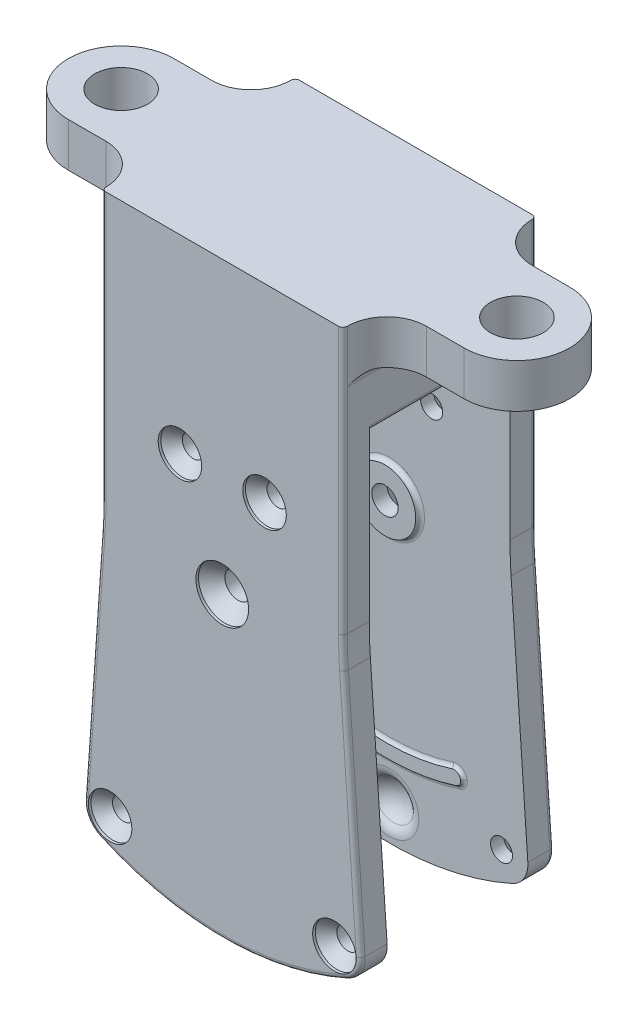
from build123d import *

# Parameters (mm, degrees)
SKETCH1_R                                      = 1.25
SKETCH1_R_2                                    = 1.5
BOSS_EXTRUDE1_DEPTH                            = 3
SKETCH6_W                                      = 27.433011382
SKETCH6_H                                      = 22
BOSS_EXTRUDE2_DEPTH                            = 7
BOSS_EXTRUDE3_DEPTH                            = 8
CSK_FOR_M2_5_FLAT_HEAD_MACHINE_SCREW1_AT_COUNT = 2
CSK_FOR_M2_5_FLAT_HEAD_MACHINE_SCREW1_AT_PITCH = 9.618218297
CSK_FOR_M2_5_FLAT_HEAD_MACHINE_SCREW_2_COUNT   = 2
CSK_FOR_M2_5_FLAT_HEAD_MACHINE_SCREW_2_PITCH   = 40.473868267
CSK_FOR_M2_5_FLAT_HEAD_MACHINE_SCREW_3_COUNT   = 2
CSK_FOR_M2_5_FLAT_HEAD_MACHINE_SCREW_3_PITCH   = 43.398601527
CSK_FOR_M2_5_FLAT_HEAD_MACHINE_SCREW2_AT_COUNT = 2
CSK_FOR_M2_5_FLAT_HEAD_MACHINE_SCREW2_AT_PITCH = 9.618218297
CSK_FOR_M2_5_FLAT_HEAD_MACHINE_SCREW_4_COUNT   = 2
CSK_FOR_M2_5_FLAT_HEAD_MACHINE_SCREW_4_PITCH   = 40.473868267
CSK_FOR_M2_5_FLAT_HEAD_MACHINE_SCREW_5_COUNT   = 2
CSK_FOR_M2_5_FLAT_HEAD_MACHINE_SCREW_5_PITCH   = 43.398601527
SKETCH18_R                                     = 0.5
BOSS_EXTRUDE4_DEPTH                            = 2.5
BOSS_EXTRUDE5_DEPTH                            = 0.3
BOSS_EXTRUDE7_START                            = 0.3
BOSS_EXTRUDE7_DEPTH                            = 0.3
SKETCH22_R                                     = 3.5
SKETCH22_R_2                                   = 1.5
BOSS_EXTRUDE8_DEPTH                            = 0.5
BOSS_EXTRUDE9_START                            = 0.5
SKETCH23_R                                     = 3.5
SKETCH23_R_2                                   = 1.5
BOSS_EXTRUDE9_DEPTH                            = 0.5
FILLET4_R                                      = 0.5
FILLET7_R                                      = 0.75
FILLET6_R                                      = 0.5
FILLET9_R                                      = 0.5
FILLET10_R                                     = 1.5
FILLET12_R                                     = 1.9
FILLET11_R                                     = 0.5
BOSS_EXTRUDE11_DEPTH                           = 3
SKETCH24_R                                     = 6
SKETCH24_R_2                                   = 3
BOSS_EXTRUDE10_DEPTH                           = 5
FILLET13_R                                     = 4.5
FILLET14_R                                     = 1


# Some blends are built 0.0001 mm under size
with BuildPart() as part:
    # Sketch1 → Boss-Extrude1 (new body)
    with BuildSketch(Plane.XY):
        with BuildLine():
            Line((13.716505691, 23), (-13.716505691, 23))
            Line((-13.716505691, 23), (-13.716505691, 2.705189989))
            ThreePointArc((-13.716505691, 2.705189989), (-13.74696434, 0.960215153), (-13.838303178, -0.782633699))
            Line((-13.838303178, -0.782633699), (-15.74477338, -28.04642778))
            ThreePointArc((-15.74477338, -28.04642778), (-15.327486992, -29.79429564), (-13.986153606, -30.990119511))
            ThreePointArc((-13.986153606, -30.990119511), (0, -34), (13.986153606, -30.990119511))
            ThreePointArc((13.986153606, -30.990119511), (15.327486992, -29.79429564), (15.74477338, -28.04642778))
            Line((15.74477338, -28.04642778), (13.838303178, -0.782633699))
            ThreePointArc((13.838303178, -0.782633699), (13.74696434, 0.960215153), (13.716505691, 2.705189989))
            Line((13.716505691, 2.705189989), (13.716505691, 23))
        make_face()
        with Locations((4.809109148, 11.431116818)):
            Circle(SKETCH1_R, mode=Mode.SUBTRACT)
        with Locations((-4.809109148, 11.431116818)):
            Circle(SKETCH1_R, mode=Mode.SUBTRACT)
        with Locations((-12.752081229, -28.255697201)):
            Circle(SKETCH1_R, mode=Mode.SUBTRACT)
        with Locations((12.752081229, -28.255697201)):
            Circle(SKETCH1_R, mode=Mode.SUBTRACT)
        Circle(SKETCH1_R_2, mode=Mode.SUBTRACT)
    extrude(amount=BOSS_EXTRUDE1_DEPTH)


with BuildPart() as body_2:
    # Mirror3: mirrored copy
    add(part.part.mirror(Plane(origin=(0, 0, -8), x_dir=(1, 0, 0), z_dir=(0, 0, -1))))


with BuildPart() as part_1:
    add(part.part)

    add(body_2.part)  # Boss-Extrude2 merges body 2
    # Sketch6 → Boss-Extrude2 (add)
    with BuildSketch(Plane(origin=(0, 23, 0), x_dir=(1, 0, 0), z_dir=(0, 1, 0))):
        with Locations((0, 8)):
            Rectangle(SKETCH6_W, SKETCH6_H)
    extrude(amount=BOSS_EXTRUDE2_DEPTH)

    # Sketch10 → Boss-Extrude3 (add, symmetric)
    with BuildSketch(Plane.XY.offset(-8)):
        Polygon((8.716505691, 23), (8.716505691, 21.091851569), (13.716505691, 21.441485628), (13.716505691, 23), align=None)
        Polygon((-13.716505691, 21.441485628), (-8.716505691, 21.091851569), (-8.716505691, 23), (-13.716505691, 23), align=None)
    extrude(amount=BOSS_EXTRUDE3_DEPTH, both=True)

    # Sketch5 → CSK for M2.5 Flat Head Machine Screw1 (revolve, cut)
    with BuildSketch(Plane(origin=(-4.809109148, 11.431116818, 3), x_dir=(0, -1, 0), z_dir=(1, 0, 0))):
        Polygon((0, 0), (0, 5.751075774), (1.25, 5), (1.25, 1.525), (2.475, 0.3), (2.475, 0), align=None)
    csk_for_m2_5_flat_head_machine_screw1 = revolve(axis=Axis((-4.809109148, 11.431116818, 9.35), (0, 0, -1)), mode=Mode.SUBTRACT)

    # CSK for M2.5 Flat Head Machine Screw1 at: CSK for M2.5 Flat Head Machine Screw1 ×2
    with Locations(*[(i * CSK_FOR_M2_5_FLAT_HEAD_MACHINE_SCREW1_AT_PITCH, 0, 0) for i in range(1, CSK_FOR_M2_5_FLAT_HEAD_MACHINE_SCREW1_AT_COUNT)]):
        add(csk_for_m2_5_flat_head_machine_screw1, mode=Mode.SUBTRACT)

    # CSK for M2.5 Flat Head Machine Screw 2: CSK for M2.5 Flat Head Machine Screw1 ×2
    with Locations(*[Vector(-0.19624939301952804, -0.9805540146975418, 0) * (i * CSK_FOR_M2_5_FLAT_HEAD_MACHINE_SCREW_2_PITCH) for i in range(1, CSK_FOR_M2_5_FLAT_HEAD_MACHINE_SCREW_2_COUNT)]):
        add(csk_for_m2_5_flat_head_machine_screw1, mode=Mode.SUBTRACT)

    # CSK for M2.5 Flat Head Machine Screw 3: CSK for M2.5 Flat Head Machine Screw1 ×2
    with Locations(*[Vector(0.40464876192922455, -0.9144721862742168, 0) * (i * CSK_FOR_M2_5_FLAT_HEAD_MACHINE_SCREW_3_PITCH) for i in range(1, CSK_FOR_M2_5_FLAT_HEAD_MACHINE_SCREW_3_COUNT)]):
        add(csk_for_m2_5_flat_head_machine_screw1, mode=Mode.SUBTRACT)

    # Sketch14 → CSK for M2.5 Flat Head Machine Screw2 (revolve, cut)
    with BuildSketch(Plane(origin=(4.809109148, 11.431116818, -19), x_dir=(0, 1, 0), z_dir=(1, 0, 0))):
        Polygon((0, 0), (0, 5.751075774), (1.25, 5), (1.25, 1.525), (2.475, 0.3), (2.475, 0), align=None)
    csk_for_m2_5_flat_head_machine_screw2 = revolve(axis=Axis((4.809109148, 11.431116818, -25.35), (0, 0, 1)), mode=Mode.SUBTRACT)

    # CSK for M2.5 Flat Head Machine Screw2 at: CSK for M2.5 Flat Head Machine Screw2 ×2
    with Locations(*[(-i * CSK_FOR_M2_5_FLAT_HEAD_MACHINE_SCREW2_AT_PITCH, 0, 0) for i in range(1, CSK_FOR_M2_5_FLAT_HEAD_MACHINE_SCREW2_AT_COUNT)]):
        add(csk_for_m2_5_flat_head_machine_screw2, mode=Mode.SUBTRACT)

    # CSK for M2.5 Flat Head Machine Screw 4: CSK for M2.5 Flat Head Machine Screw2 ×2
    with Locations(*[Vector(0.19624939301952826, -0.9805540146975418, 0) * (i * CSK_FOR_M2_5_FLAT_HEAD_MACHINE_SCREW_4_PITCH) for i in range(1, CSK_FOR_M2_5_FLAT_HEAD_MACHINE_SCREW_4_COUNT)]):
        add(csk_for_m2_5_flat_head_machine_screw2, mode=Mode.SUBTRACT)

    # CSK for M2.5 Flat Head Machine Screw 5: CSK for M2.5 Flat Head Machine Screw2 ×2
    with Locations(*[Vector(-0.4046487619292244, -0.9144721862742169, 0) * (i * CSK_FOR_M2_5_FLAT_HEAD_MACHINE_SCREW_5_PITCH) for i in range(1, CSK_FOR_M2_5_FLAT_HEAD_MACHINE_SCREW_5_COUNT)]):
        add(csk_for_m2_5_flat_head_machine_screw2, mode=Mode.SUBTRACT)

    # Sketch3 → CSK for M3 Flat Head Machine Screw1 (revolve, cut)
    with BuildSketch(Plane(origin=(0, 0, 3), x_dir=(0, -1, 0), z_dir=(1, 0, 0))):
        Polygon((0, 0), (0, 5.901290929), (1.5, 5), (1.5, 1.8), (3, 0.3), (3, 0), align=None)
    revolve(axis=Axis((0, 0, 9.35), (0, 0, -1)), mode=Mode.SUBTRACT)

    # Sketch16 → CSK for M3 Flat Head Machine Screw2 (revolve, cut)
    with BuildSketch(Plane(origin=(0, 0, -19), x_dir=(0, 1, 0), z_dir=(1, 0, 0))):
        Polygon((0, 0), (0, 5.901290929), (1.5, 5), (1.5, 1.8), (3, 0.3), (3, 0), align=None)
    revolve(axis=Axis((0, 0, -25.35), (0, 0, 1)), mode=Mode.SUBTRACT)

    # Sketch17 → Cut-Revolve2 (revolve, cut)
    with BuildSketch(Plane(origin=(0, -30, 0), x_dir=(-1, 0, 0), z_dir=(0, -1, 0))):
        with BuildLine():
            Line((0, -1.5), (0, 4.5))
            ThreePointArc((0, 4.5), (-3, 1.5), (0, -1.5))
        make_face()
        with BuildLine():
            Line((0, 11.5), (0, 17.5))
            ThreePointArc((0, 17.5), (-3, 14.5), (0, 11.5))
        make_face()
    revolve(axis=Axis((0, -30, 4.1), (0, 0, -1)), mode=Mode.SUBTRACT)

    # Sketch18 → Boss-Extrude4 (add, symmetric)
    with BuildSketch(Plane(origin=(0, 0, 0), x_dir=(0, 0, -1), z_dir=(1, 0, 0))):
        Polygon((19, 7.878679656), (19, 10), (21.75, 7.25), (21.75, 3.628679656), (20.25, 3.628679656), (20.25, 6.628679656), align=None)
        with Locations((20.25, 4.128679656)):
            Circle(SKETCH18_R)
    extrude(amount=BOSS_EXTRUDE4_DEPTH, both=True)

    # Sketch19 → Boss-Extrude5 (add)
    with BuildSketch(Plane(origin=(0, 0, 0), x_dir=(-1, 0, 0), z_dir=(0, 0, -1))):
        with BuildLine():
            ThreePointArc((-8.448896545, -24.059637303), (0, -25.5), (8.448896545, -24.059637303))
            Line((8.448896545, -24.059637303), (8.340134646, -22.504269686))
            ThreePointArc((8.340134646, -22.504269686), (0, -24), (-8.340134646, -22.504269686))
            Line((-8.340134646, -22.504269686), (-8.448896545, -24.059637303))
        make_face()
    extrude(amount=BOSS_EXTRUDE5_DEPTH)

    # Sketch21 → Boss-Extrude7 (add)
    with BuildSketch(Plane.XY.offset(-16).offset(BOSS_EXTRUDE7_START)):
        with BuildLine():
            Line((8.448896545, -24.059637303), (8.340134646, -22.504269686))
            ThreePointArc((8.340134646, -22.504269686), (0, -24), (-8.340134646, -22.504269686))
            Line((-8.340134646, -22.504269686), (-8.448896545, -24.059637303))
            ThreePointArc((-8.448896545, -24.059637303), (0, -25.5), (8.448896545, -24.059637303))
        make_face()
    extrude(amount=-BOSS_EXTRUDE7_DEPTH)

    # Sketch22 → Boss-Extrude8 (add)
    with BuildSketch(Plane(origin=(0, 0, 0), x_dir=(-1, 0, 0), z_dir=(0, 0, -1))):
        with Locations(Location((0, 0, 0), (0, 0, 180))):
            Circle(SKETCH22_R)
        Circle(SKETCH22_R_2, mode=Mode.SUBTRACT)
    extrude(amount=BOSS_EXTRUDE8_DEPTH)

    # Sketch23 → Boss-Extrude9 (add)
    with BuildSketch(Plane.XY.offset(-16).offset(BOSS_EXTRUDE9_START)):
        Circle(SKETCH23_R)
        with Locations(Location((0, 0, 0), (0, 0, 180))):
            Circle(SKETCH23_R_2, mode=Mode.SUBTRACT)
    extrude(amount=-BOSS_EXTRUDE9_DEPTH)

    # Fillet4
    fillet4_edges = [part_1.edges().sort_by_distance(p)[0] for p in [
        (0, 3.628679656, -21.75),
        (0, 7.25, -21.75),
        (0, 10, -19),
        (0, 7.878679656, -19),
        (0, 6.628679656, -20.25),
    ]]
    fillet(fillet4_edges, radius=FILLET4_R)

    # Fillet7
    fillet7_edges = [part_1.edges().sort_by_distance(p)[0] for p in [
        (-8.340134646, -22.504269686, -0.15),
        (-8.448896545, -24.059637303, -0.15),
        (8.448896545, -24.059637303, -0.15),
        (8.340134646, -22.504269686, -0.15),
        (8.448896545, -24.059637303, -15.85),
        (8.340134646, -22.504269686, -15.85),
        (-8.340134646, -22.504269686, -15.85),
        (-8.448896545, -24.059637303, -15.85),
    ]]
    fillet(fillet7_edges, radius=FILLET7_R - 0.0001)  # a hair under: the kernel refuses the full size

    # Fillet6
    # the kernel refuses this fillet: 0.5 mm, written as the material it adds along each edge
    with BuildSketch(Plane(origin=(7.660447754, -23.534550988, 0), x_dir=(0.9975640502598241, 0.06975647374412708, 0), z_dir=(0.06975647374412708, -0.9975640502598241, 0))) as fillet6_piece_1:
        with BuildLine():
            CenterArc((1.208157569, -0.5), FILLET6_R, 90, 66.421821522)
            Line((0.7499, -0.3), (0.740734849, -0.296))
            ThreePointArc((0.740734849, -0.296), (0.7399, -0.15), (0.7399, 0))
            Line((0.7399, 0), (0.7499, 0.01))
            Line((0.7499, 0.01), (1.208157569, 0.01))
            Line((1.208157569, 0.01), (1.208157569, 0))
        make_face()
    revolve(axis=Axis((7.660447754, -23.534550988, 0), (0, 0, 1)), revolution_arc=104.029961865)
    with BuildSketch(Plane(origin=(7.660462134, -23.534756636, 0), x_dir=(0.9975640502598243, 0.06975647374412236, 0), z_dir=(-0.06975647374412236, 0.9975640502598243, 0))) as fillet6_piece_2:
        with BuildLine():
            CenterArc((1.208157569, 0.5), FILLET6_R, 203.578178478, 66.421821522)
            Line((0.7499, 0.3), (0.740734849, 0.296))
            ThreePointArc((0.740734849, 0.296), (0.7399, 0.15), (0.7399, 0))
            Line((0.7399, 0), (0.7499, -0.01))
            Line((0.7499, -0.01), (1.208157569, -0.01))
            Line((1.208157569, -0.01), (1.208157569, 0))
        make_face()
    revolve(axis=Axis((7.660462134, -23.534756636, 0), (0, 0, -1)), revolution_arc=75.97015383)
    with BuildSketch(Plane(origin=(0, 0, 0), x_dir=(0.3095123710239046, -0.9508954160070184, 0), z_dir=(0.9508954160070184, 0.3095123710239046, 0))) as fillet6_piece_3:
        with BuildLine():
            CenterArc((25.958257569, 0.5), FILLET6_R, 203.578178478, 66.421821522)
            Line((25.5, 0.3), (25.490834849, 0.296))
            ThreePointArc((25.490834849, 0.296), (25.49, 0.15), (25.49, 0))
            Line((25.49, 0), (25.5, -0.01))
            Line((25.5, -0.01), (25.958257569, -0.01))
            Line((25.958257569, -0.01), (25.958257569, 0))
        make_face()
    revolve(axis=Axis((0, 0, 0), (0, 0, -1)), revolution_arc=36.059692341)
    with BuildSketch(Plane(origin=(-7.660462134, -23.534756636, 0), x_dir=(-0.30951237102390705, -0.9508954160070178, 0), z_dir=(0.9508954160070178, -0.30951237102390705, 0))) as fillet6_piece_4:
        with BuildLine():
            CenterArc((1.208157569, 0.5), FILLET6_R, 203.578178478, 66.421821522)
            Line((0.7499, 0.3), (0.740734849, 0.296))
            ThreePointArc((0.740734849, 0.296), (0.7399, 0.15), (0.7399, 0))
            Line((0.7399, 0), (0.7499, -0.01))
            Line((0.7499, -0.01), (1.208157569, -0.01))
            Line((1.208157569, -0.01), (1.208157569, 0))
        make_face()
    revolve(axis=Axis((-7.660462134, -23.534756636, 0), (0, 0, -1)), revolution_arc=75.97015383)
    with BuildSketch(Plane(origin=(-7.660447754, -23.534550988, 0), x_dir=(0.30951429112080886, 0.9508947910215846, 0), z_dir=(0.9508947910215846, -0.30951429112080886, 0))) as fillet6_piece_5:
        with BuildLine():
            CenterArc((1.208157569, -0.5), FILLET6_R, 90, 66.421821522)
            Line((0.7499, -0.3), (0.740734849, -0.296))
            ThreePointArc((0.740734849, -0.296), (0.7399, -0.15), (0.7399, 0))
            Line((0.7399, 0), (0.7499, 0.01))
            Line((0.7499, 0.01), (1.208157569, 0.01))
            Line((1.208157569, 0.01), (1.208157569, 0))
        make_face()
    revolve(axis=Axis((-7.660447754, -23.534550988, 0), (0, 0, 1)), revolution_arc=104.029961865)
    with BuildSketch(Plane(origin=(0, 0, 0), x_dir=(-0.30951429112081225, -0.9508947910215835, 0), z_dir=(-0.9508947910215835, 0.30951429112081225, 0))) as fillet6_piece_6:
        with BuildLine():
            CenterArc((23.541742431, -0.5), FILLET6_R, 23.578178478, 66.421821522)
            Line((24, -0.3), (24.009165151, -0.296))
            ThreePointArc((24.009165151, -0.296), (24.01, -0.15), (24.01, 0))
            Line((24.01, 0), (24, 0.01))
            Line((24, 0.01), (23.541742431, 0.01))
            Line((23.541742431, 0.01), (23.541742431, 0))
        make_face()
    revolve(axis=Axis((0, 0, 0), (0, 0, 1)), revolution_arc=36.05992373)
    with BuildSketch(Plane(origin=(-7.660462134, -23.534756636, -16), x_dir=(-0.9975640502598259, 0.06975647374410343, 0), z_dir=(0.06975647374410343, 0.9975640502598259, 0))) as fillet6_piece_7:
        with BuildLine():
            CenterArc((1.208157569, 0.5), FILLET6_R, 203.578178478, 66.421821522)
            Line((0.7499, 0.3), (0.740734849, 0.296))
            ThreePointArc((0.740734849, 0.296), (0.7399, 0.15), (0.7399, 0))
            Line((0.7399, 0), (0.7499, -0.01))
            Line((0.7499, -0.01), (1.208157569, -0.01))
            Line((1.208157569, -0.01), (1.208157569, 0))
        make_face()
    revolve(axis=Axis((-7.660462134, -23.534756636, -16), (0, 0, 1)), revolution_arc=75.97015383)
    with BuildSketch(Plane(origin=(-7.660447754, -23.534550988, -16), x_dir=(-0.9975640502598254, 0.06975647374410814, 0), z_dir=(-0.06975647374410814, -0.9975640502598254, 0))) as fillet6_piece_8:
        with BuildLine():
            CenterArc((1.208157569, -0.5), FILLET6_R, 90, 66.421821522)
            Line((0.7499, -0.3), (0.740734849, -0.296))
            ThreePointArc((0.740734849, -0.296), (0.7399, -0.15), (0.7399, 0))
            Line((0.7399, 0), (0.7499, 0.01))
            Line((0.7499, 0.01), (1.208157569, 0.01))
            Line((1.208157569, 0.01), (1.208157569, 0))
        make_face()
    revolve(axis=Axis((-7.660447754, -23.534550988, -16), (0, 0, -1)), revolution_arc=104.029961865)
    with BuildSketch(Plane(origin=(0, 0, -16), x_dir=(0.30951429112081263, -0.9508947910215834, 0), z_dir=(0.9508947910215834, 0.30951429112081263, 0))) as fillet6_piece_9:
        with BuildLine():
            CenterArc((23.541742431, -0.5), FILLET6_R, 23.578178478, 66.421821522)
            Line((24, -0.3), (24.009165151, -0.296))
            ThreePointArc((24.009165151, -0.296), (24.01, -0.15), (24.01, 0))
            Line((24.01, 0), (24, 0.01))
            Line((24, 0.01), (23.541742431, 0.01))
            Line((23.541742431, 0.01), (23.541742431, 0))
        make_face()
    revolve(axis=Axis((0, 0, -16), (0, 0, -1)), revolution_arc=36.05992373)
    with BuildSketch(Plane(origin=(7.660447754, -23.534550988, -16), x_dir=(-0.30951429112081563, 0.9508947910215824, 0), z_dir=(-0.9508947910215824, -0.30951429112081563, 0))) as fillet6_piece_10:
        with BuildLine():
            CenterArc((1.208157569, -0.5), FILLET6_R, 90, 66.421821522)
            Line((0.7499, -0.3), (0.740734849, -0.296))
            ThreePointArc((0.740734849, -0.296), (0.7399, -0.15), (0.7399, 0))
            Line((0.7399, 0), (0.7499, 0.01))
            Line((0.7499, 0.01), (1.208157569, 0.01))
            Line((1.208157569, 0.01), (1.208157569, 0))
        make_face()
    revolve(axis=Axis((7.660447754, -23.534550988, -16), (0, 0, -1)), revolution_arc=104.029961865)
    with BuildSketch(Plane(origin=(7.660462134, -23.534756636, -16), x_dir=(0.30951237102390705, -0.9508954160070178, 0), z_dir=(-0.9508954160070178, -0.30951237102390705, 0))) as fillet6_piece_11:
        with BuildLine():
            CenterArc((1.208157569, 0.5), FILLET6_R, 203.578178478, 66.421821522)
            Line((0.7499, 0.3), (0.740734849, 0.296))
            ThreePointArc((0.740734849, 0.296), (0.7399, 0.15), (0.7399, 0))
            Line((0.7399, 0), (0.7499, -0.01))
            Line((0.7499, -0.01), (1.208157569, -0.01))
            Line((1.208157569, -0.01), (1.208157569, 0))
        make_face()
    revolve(axis=Axis((7.660462134, -23.534756636, -16), (0, 0, 1)), revolution_arc=75.97015383)
    with BuildSketch(Plane(origin=(0, 0, -16), x_dir=(-0.30951237102390733, -0.9508954160070175, 0), z_dir=(-0.9508954160070175, 0.30951237102390733, 0))) as fillet6_piece_12:
        with BuildLine():
            CenterArc((25.958257569, 0.5), FILLET6_R, 203.578178478, 66.421821522)
            Line((25.5, 0.3), (25.490834849, 0.296))
            ThreePointArc((25.490834849, 0.296), (25.49, 0.15), (25.49, 0))
            Line((25.49, 0), (25.5, -0.01))
            Line((25.5, -0.01), (25.958257569, -0.01))
            Line((25.958257569, -0.01), (25.958257569, 0))
        make_face()
    revolve(axis=Axis((0, 0, -16), (0, 0, 1)), revolution_arc=36.059692341)
    with BuildSketch(Plane(origin=(8.408535415, -23.482446256, -16), x_dir=(0.9975640502598241, 0.06975647374412629, 0), z_dir=(-0.06975647374412629, 0.9975640502598242, 0)), Plane(origin=(-8.408521035, -23.482240609, -16), x_dir=(-0.9975640502598253, 0.06975647374411009, 0), z_dir=(-0.06975647374411009, -0.9975640502598253, 0)), Plane(origin=(-8.408535415, -23.482446256, 0), x_dir=(-0.9975640502598242, 0.06975647374412512, 0), z_dir=(0.06975647374412512, 0.9975640502598243, 0)), Plane(origin=(8.408521035, -23.482240609, 0), x_dir=(0.9975640502598244, 0.0697564737441248, 0), z_dir=(0.0697564737441248, -0.9975640502598243, 0))) as fillet6_piece_13:
        with BuildLine():
            CenterArc((0.458257569, -0.5), FILLET6_R, 90, 66.421821522)
            Line((0, -0.3), (-0.009165151, -0.296))
            ThreePointArc((-0.009165151, -0.296), (-0.01, -0.15), (-0.01, 0))
            Line((-0.01, 0), (0, 0.01))
            Line((0, 0.01), (0.458257569, 0.01))
            Line((0.458257569, 0.01), (0.458257569, 0))
        make_face()
    extrude(amount=0.00020615)

    # Fillet9
    fillet9_edges = [part_1.edges().sort_by_distance(p)[0] for p in [
        (-3.5, 0, 0),
        (-3.5, 0, -16),
    ]]
    fillet(fillet9_edges, radius=FILLET9_R - 0.0001)  # a hair under: the kernel refuses the full size

    # Fillet10
    fillet10_edges = [part_1.edges().sort_by_distance(p)[0] for p in [
        (-2.598076211, -30, 0),
        (-2.598076211, -30, -16),
    ]]
    fillet(fillet10_edges, radius=FILLET10_R)

    # Fillet12
    fillet12_edges = [part_1.edges().sort_by_distance(p)[0] for p in [
        (0, 23, -16),
        (0, 23, 0),
        (-8.716505691, 23, -8),
        (8.716505691, 23, -8),
    ]]
    fillet(fillet12_edges, radius=FILLET12_R)

    # Fillet11
    fillet11_edges = [part_1.edges().sort_by_distance(p)[0] for p in [
        (-13.716505691, 21.441485628, -8),
        (0, -34, 3),
        (13.716505691, 21.441485628, -8),
        (15.327486992, -29.79429564, 3),
        (14.791538279, -14.414530739, 3),
        (13.74696434, 0.960215153, 3),
        (13.716505691, 16.352594994, 3),
        (-13.716505691, 16.352594994, 3),
        (-13.74696434, 0.960215153, 3),
        (-14.791538279, -14.414530739, 3),
        (13.716505691, 16.352594994, -19),
        (-13.716505691, 16.352594994, -19),
        (-15.327486992, -29.79429564, 3),
        (-13.74696434, 0.960215153, -19),
        (13.74696434, 0.960215153, -19),
        (-15.327486992, -29.79429564, -19),
        (0, -34, -19),
        (15.327486992, -29.79429564, -19),
        (14.791538279, -14.414530739, -19),
        (-14.791538279, -14.414530739, -19),
    ]]
    fillet(fillet11_edges, radius=FILLET11_R)

    # Sketch25 → Boss-Extrude11 (add)
    with BuildSketch(Plane(origin=(0, 30, 0), x_dir=(1, 0, 0), z_dir=(0, 1, 0))):
        with BuildLine():
            Line((13.216505691, 19), (-13.216505691, 19))
            ThreePointArc((-13.216505691, 19), (-13.570059082, 18.853553391), (-13.716505691, 18.5))
            Line((-13.716505691, 18.5), (-13.716505691, -2.5))
            ThreePointArc((-13.716505691, -2.5), (-13.570059082, -2.853553391), (-13.216505691, -3))
            Line((-13.216505691, -3), (13.216505691, -3))
            ThreePointArc((13.216505691, -3), (13.570059082, -2.853553391), (13.716505691, -2.5))
            Line((13.716505691, -2.5), (13.716505691, 18.5))
            ThreePointArc((13.716505691, 18.5), (13.570059082, 18.853553391), (13.216505691, 19))
        make_face()
    extrude(amount=BOSS_EXTRUDE11_DEPTH)

    # Sketch24 → Boss-Extrude10 (add)
    # profile 1 of 6: a face of its own
    with BuildSketch(Plane(origin=(0, 33, 0), x_dir=(1, 0, 0), z_dir=(0, 1, 0))):
        with BuildLine():
            Line((22.5, 14), (13.716505691, 14))
            Line((13.716505691, 14), (13.716505691, 2))
            Line((13.716505691, 2), (22.5, 2))
            ThreePointArc((22.5, 2), (16.5, 8), (22.5, 14))
        make_face()
    # profile 2 of 6: a face of its own
    with BuildSketch(Plane(origin=(0, 33, 0), x_dir=(1, 0, 0), z_dir=(0, 1, 0))):
        with Locations((22.5, 8)):
            Circle(SKETCH24_R)
        with Locations(Location((22.5, 8, 0), (0, 0, 270))):
            Circle(SKETCH24_R_2, mode=Mode.SUBTRACT)
    # profile 3 of 6: a face of its own
    with BuildSketch(Plane(origin=(0, 33, 0), x_dir=(1, 0, 0), z_dir=(0, 1, 0))):
        with BuildLine():
            Line((22.5, 14), (13.716505691, 14))
            Line((13.716505691, 14), (13.716505691, 2))
            Line((13.716505691, 2), (22.5, 2))
            ThreePointArc((22.5, 2), (16.5, 8), (22.5, 14))
        make_face()
    # profile 4 of 6: a face of its own
    with BuildSketch(Plane(origin=(0, 33, 0), x_dir=(1, 0, 0), z_dir=(0, 1, 0))):
        with BuildLine():
            Line((-13.716505691, 14), (-22.5, 14))
            ThreePointArc((-22.5, 14), (-18.257359313, 12.242640687), (-16.5, 8))
            ThreePointArc((-16.5, 8), (-18.257359313, 3.757359313), (-22.5, 2))
            Line((-22.5, 2), (-13.716505691, 2))
            Line((-13.716505691, 2), (-13.716505691, 14))
        make_face()
    # profile 5 of 6: a face of its own
    with BuildSketch(Plane(origin=(0, 33, 0), x_dir=(1, 0, 0), z_dir=(0, 1, 0))):
        with BuildLine():
            Line((-13.716505691, 14), (-22.5, 14))
            ThreePointArc((-22.5, 14), (-18.257359313, 12.242640687), (-16.5, 8))
            ThreePointArc((-16.5, 8), (-18.257359313, 3.757359313), (-22.5, 2))
            Line((-22.5, 2), (-13.716505691, 2))
            Line((-13.716505691, 2), (-13.716505691, 14))
        make_face()
    # profile 6 of 6: a face of its own
    with BuildSketch(Plane(origin=(0, 33, 0), x_dir=(1, 0, 0), z_dir=(0, 1, 0))):
        with Locations((-22.5, 8)):
            Circle(SKETCH24_R)
        with Locations(Location((-22.5, 8, 0), (0, 0, 270))):
            Circle(SKETCH24_R_2, mode=Mode.SUBTRACT)
    extrude(amount=-BOSS_EXTRUDE10_DEPTH)

    # Fillet13
    fillet13_edges = [part_1.edges().sort_by_distance(p)[0] for p in [
        (13.716505691, 30.5, -14),
        (13.716505691, 30.5, -2),
        (-13.716505691, 30.5, -2),
        (-13.716505691, 30.5, -14),
    ]]
    fillet(fillet13_edges, radius=FILLET13_R - 0.0001)  # a hair under: the kernel refuses the full size

    # Fillet14
    fillet14_edges = [part_1.edges().sort_by_distance(p)[0] for p in [
        (13.716505691, 28, -8),
        (-13.716505691, 28, -8),
    ]]
    fillet(fillet14_edges, radius=FILLET14_R)


solid = part_1.part
